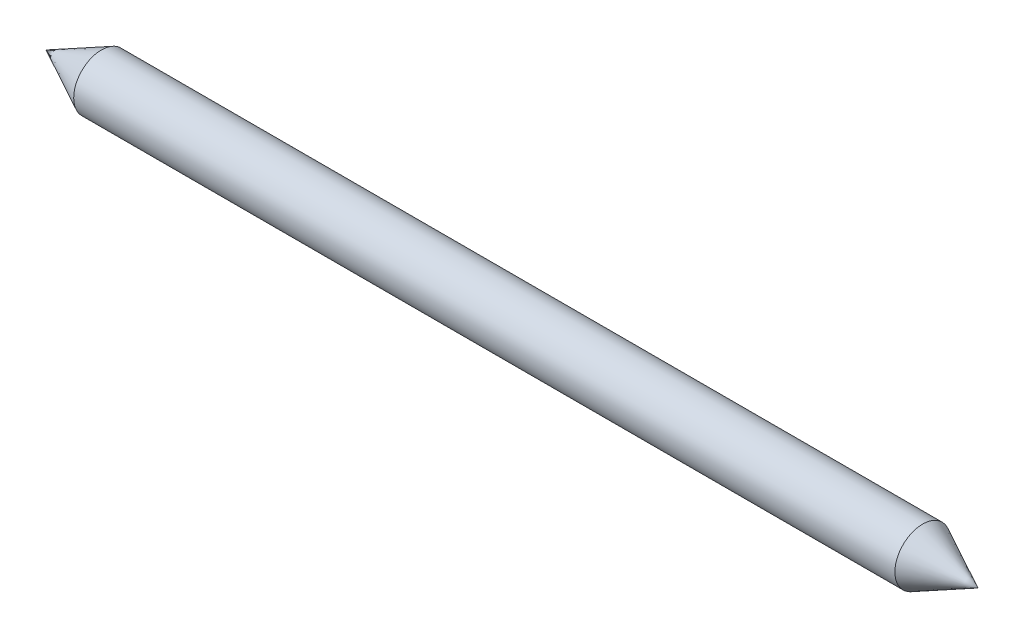
from build123d import *


with BuildPart() as part:
    # Sketch1 → Revolve1 (revolve)
    with BuildSketch(Plane(origin=(0, 0, 0), x_dir=(1, 0, 0), z_dir=(0, 1, 0))):
        Polygon((-213.6775, 0), (213.6775, 0), (188.2775, 12.7), (-188.2775, 12.7), align=None)
    revolve(axis=Axis((-213.6775, 0, 0), (1, 0, 0)))


solid = part.part
